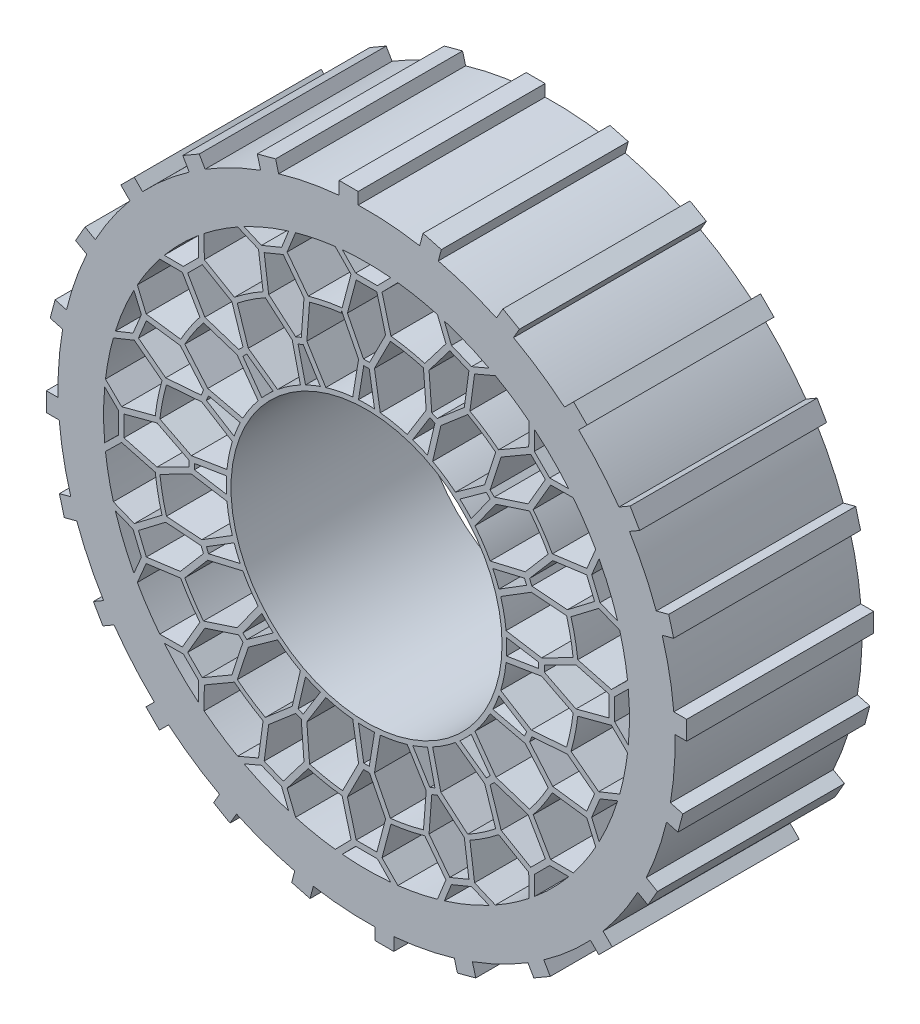
from build123d import *

# Parameters (mm, degrees)
SKETCH1_R           = 73.66
BOSS_EXTRUDE1_DEPTH = 101.6
SKETCH2_R           = 146.05
SKETCH2_R_2         = 142.875
BOSS_EXTRUDE2_DEPTH = 101.6
SKETCH4_R           = 167.64
SKETCH4_R_2         = 146.05
BOSS_EXTRUDE3_DEPTH = 101.6
BOSS_EXTRUDE5_START = -5.08
SKETCH9_W           = 101.6
SKETCH9_H           = 10.313130633
BOSS_EXTRUDE5_DEPTH = 11.43
CIRPATTERN1_COUNT   = 24
SCALE3_SCALE        = 0.85
SCALE9_SCALE        = 0.3


with BuildPart() as part:
    # Sketch1 → Boss-Extrude1 (new body)
    with BuildSketch(Plane.XY):
        with BuildLine():
            Line((38.552606872, 137.575296214), (43.145167195, 126.177323825))
            Line((43.145167195, 126.177323825), (31.670754728, 111.145797019))
            ThreePointArc((31.670754728, 111.145797019), (22.546588515, 113.349354856), (13.273693024, 114.805200115))
            Line((13.273693024, 114.805200115), (8.42503447, 133.083587621))
            Line((8.42503447, 133.083587621), (17.029822149, 141.856444276))
            ThreePointArc((17.029822149, 141.856444276), (15.09800635, 142.075035912), (13.163395022, 142.267321112))
            Line((13.163395022, 142.267321112), (5.911713965, 134.874))
            Line((5.911713965, 134.874), (-5.911713965, 134.874))
            Line((-5.911713965, 134.874), (-13.163395022, 142.267321112))
            ThreePointArc((-13.163395022, 142.267321112), (-15.09800635, 142.075035912), (-17.029822149, 141.856444276))
            Line((-17.029822149, 141.856444276), (-8.42503447, 133.083587621))
            Line((-8.42503447, 133.083587621), (-13.273693024, 114.805200115))
            ThreePointArc((-13.273693024, 114.805200115), (-22.546588515, 113.349354856), (-31.670754728, 111.145797019))
            Line((-31.670754728, 111.145797019), (-43.145167195, 126.177323825))
            Line((-43.145167195, 126.177323825), (-38.552606872, 137.575296214))
            ThreePointArc((-38.552606872, 137.575296214), (-40.421023348, 137.037974651), (-42.281955517, 136.47527931))
            Line((-42.281955517, 136.47527931), (-46.152333723, 126.869643059))
            Line((-46.152333723, 126.869643059), (-57.075756791, 122.345013077))
            Line((-57.075756791, 122.345013077), (-66.604737996, 126.400452932))
            ThreePointArc((-66.604737996, 126.400452932), (-68.318501444, 125.482460868), (-70.019615125, 124.541234629))
            Line((-70.019615125, 124.541234629), (-58.71260101, 119.729081608))
            Line((-58.71260101, 119.729081608), (-56.197341339, 100.986552206))
            ThreePointArc((-56.197341339, 100.986552206), (-64.20725183, 96.092943094), (-71.793617169, 90.565453865))
            Line((-71.793617169, 90.565453865), (-88.146908266, 100.061706277))
            Line((-88.146908266, 100.061706277), (-88.265750978, 112.349556427))
            ThreePointArc((-88.265750978, 112.349556427), (-89.786318658, 111.138124003), (-91.290261616, 109.906113383))
            Line((-91.290261616, 109.906113383), (-91.190106973, 99.550533039))
            Line((-91.190106973, 99.550533039), (-99.550533039, 91.190106973))
            Line((-99.550533039, 91.190106973), (-109.906113383, 91.290261616))
            ThreePointArc((-109.906113383, 91.290261616), (-111.138124003, 89.786318658), (-112.349556427, 88.265750978))
            Line((-112.349556427, 88.265750978), (-100.061706277, 88.146908266))
            Line((-100.061706277, 88.146908266), (-90.565453865, 71.793617169))
            ThreePointArc((-90.565453865, 71.793617169), (-96.092943094, 64.20725183), (-100.986552206, 56.197341339))
            Line((-100.986552206, 56.197341339), (-119.729081608, 58.71260101))
            Line((-119.729081608, 58.71260101), (-124.541234628, 70.019615125))
            ThreePointArc((-124.541234629, 70.019615125), (-125.482460868, 68.318501444), (-126.400452932, 66.604737996))
            Line((-126.400452932, 66.604737996), (-122.345013077, 57.075756791))
            Line((-122.345013077, 57.075756791), (-126.869643059, 46.152333723))
            Line((-126.869643059, 46.152333723), (-136.47527931, 42.281955517))
            ThreePointArc((-136.47527931, 42.281955517), (-137.037974651, 40.421023348), (-137.575296214, 38.552606872))
            Line((-137.575296214, 38.552606872), (-126.177323825, 43.145167195))
            Line((-126.177323825, 43.145167195), (-111.145797019, 31.670754728))
            ThreePointArc((-111.145797019, 31.670754728), (-113.349354856, 22.546588515), (-114.805200115, 13.273693024))
            Line((-114.805200115, 13.273693024), (-133.083587621, 8.42503447))
            Line((-133.083587621, 8.42503447), (-141.856444276, 17.029822149))
            ThreePointArc((-141.856444276, 17.029822149), (-142.075035912, 15.09800635), (-142.267321112, 13.163395022))
            Line((-142.267321112, 13.163395022), (-134.874, 5.911713965))
            Line((-134.874, 5.911713965), (-134.874, -5.911713965))
            Line((-134.874, -5.911713965), (-142.267321112, -13.163395022))
            ThreePointArc((-142.267321112, -13.163395022), (-142.075035912, -15.09800635), (-141.856444276, -17.029822149))
            Line((-141.856444276, -17.029822149), (-133.083587621, -8.42503447))
            Line((-133.083587621, -8.42503447), (-114.805200115, -13.273693024))
            ThreePointArc((-114.805200115, -13.273693024), (-113.349354856, -22.546588515), (-111.145797019, -31.670754728))
            Line((-111.145797019, -31.670754728), (-126.177323825, -43.145167195))
            Line((-126.177323825, -43.145167195), (-137.575296214, -38.552606873))
            ThreePointArc((-137.575296214, -38.552606873), (-137.037974651, -40.421023348), (-136.47527931, -42.281955517))
            Line((-136.47527931, -42.281955517), (-126.869643059, -46.152333723))
            Line((-126.869643059, -46.152333723), (-122.345013077, -57.075756791))
            Line((-122.345013077, -57.075756791), (-126.400452932, -66.604737996))
            ThreePointArc((-126.400452932, -66.604737996), (-125.482460868, -68.318501444), (-124.541234628, -70.019615125))
            Line((-124.541234628, -70.019615125), (-119.729081608, -58.71260101))
            Line((-119.729081608, -58.71260101), (-100.986552206, -56.197341339))
            ThreePointArc((-100.986552206, -56.197341339), (-96.092943094, -64.20725183), (-90.565453865, -71.793617169))
            Line((-90.565453865, -71.793617169), (-100.061706277, -88.146908266))
            Line((-100.061706277, -88.146908266), (-112.349556426, -88.265750978))
            ThreePointArc((-112.349556427, -88.265750978), (-111.138124003, -89.786318658), (-109.906113383, -91.290261616))
            Line((-109.906113383, -91.290261616), (-99.550533039, -91.190106973))
            Line((-99.550533039, -91.190106973), (-91.190106973, -99.550533039))
            Line((-91.190106973, -99.550533039), (-91.290261616, -109.906113383))
            ThreePointArc((-91.290261616, -109.906113383), (-89.786318658, -111.138124003), (-88.265750978, -112.349556427))
            Line((-88.265750978, -112.349556427), (-88.146908266, -100.061706277))
            Line((-88.146908266, -100.061706277), (-71.793617169, -90.565453865))
            ThreePointArc((-71.793617168, -90.565453865), (-64.20725183, -96.092943094), (-56.197341339, -100.986552206))
            Line((-56.197341339, -100.986552206), (-58.71260101, -119.729081608))
            Line((-58.71260101, -119.729081608), (-70.019615125, -124.541234629))
            ThreePointArc((-70.019615125, -124.541234629), (-68.318501444, -125.482460868), (-66.604737996, -126.400452932))
            Line((-66.604737996, -126.400452932), (-57.075756791, -122.345013077))
            Line((-57.075756791, -122.345013077), (-46.152333722, -126.869643059))
            Line((-46.152333722, -126.869643059), (-42.281955517, -136.47527931))
            ThreePointArc((-42.281955517, -136.47527931), (-40.421023348, -137.037974651), (-38.552606872, -137.575296214))
            Line((-38.552606872, -137.575296214), (-43.145167195, -126.177323825))
            Line((-43.145167195, -126.177323825), (-31.670754728, -111.145797019))
            ThreePointArc((-31.670754728, -111.145797019), (-22.546588515, -113.349354856), (-13.273693024, -114.805200115))
            Line((-13.273693024, -114.805200115), (-8.42503447, -133.083587621))
            Line((-8.42503447, -133.083587621), (-17.029822149, -141.856444276))
            ThreePointArc((-17.029822149, -141.856444276), (-15.09800635, -142.075035912), (-13.163395022, -142.267321112))
            Line((-13.163395022, -142.267321112), (-5.911713965, -134.874))
            Line((-5.911713965, -134.874), (5.911713965, -134.874))
            Line((5.911713965, -134.874), (13.163395022, -142.267321112))
            ThreePointArc((13.163395022, -142.267321112), (15.09800635, -142.075035912), (17.029822149, -141.856444276))
            Line((17.029822149, -141.856444276), (8.42503447, -133.083587621))
            Line((8.42503447, -133.083587621), (13.273693024, -114.805200115))
            ThreePointArc((13.273693024, -114.805200115), (22.546588516, -113.349354856), (31.670754728, -111.145797019))
            Line((31.670754728, -111.145797019), (43.145167195, -126.177323825))
            Line((43.145167195, -126.177323825), (38.552606873, -137.575296214))
            ThreePointArc((38.552606873, -137.575296214), (40.421023348, -137.037974651), (42.281955517, -136.47527931))
            Line((42.281955517, -136.47527931), (46.152333723, -126.869643059))
            Line((46.152333723, -126.869643059), (57.075756791, -122.345013077))
            Line((57.075756791, -122.345013077), (66.604737996, -126.400452932))
            ThreePointArc((66.604737996, -126.400452932), (68.318501444, -125.482460868), (70.019615125, -124.541234628))
            Line((70.019615125, -124.541234629), (58.71260101, -119.729081608))
            Line((58.71260101, -119.729081608), (56.197341339, -100.986552206))
            ThreePointArc((56.197341339, -100.986552206), (64.20725183, -96.092943094), (71.793617169, -90.565453865))
            Line((71.793617169, -90.565453865), (88.146908267, -100.061706277))
            Line((88.146908267, -100.061706277), (88.265750978, -112.349556427))
            ThreePointArc((88.265750978, -112.349556427), (89.786318658, -111.138124003), (91.290261616, -109.906113383))
            Line((91.290261616, -109.906113383), (91.190106973, -99.550533039))
            Line((91.190106973, -99.550533039), (99.550533039, -91.190106973))
            Line((99.550533039, -91.190106973), (109.906113384, -91.290261616))
            ThreePointArc((109.906113383, -91.290261616), (111.138124003, -89.786318658), (112.349556427, -88.265750978))
            Line((112.349556427, -88.265750978), (100.061706277, -88.146908266))
            Line((100.061706277, -88.146908266), (90.565453866, -71.793617168))
            ThreePointArc((90.565453866, -71.793617168), (96.092943094, -64.20725183), (100.986552206, -56.197341339))
            Line((100.986552206, -56.197341339), (119.729081608, -58.71260101))
            Line((119.729081608, -58.71260101), (124.541234629, -70.019615125))
            ThreePointArc((124.541234629, -70.019615125), (125.482460868, -68.318501444), (126.400452932, -66.604737996))
            Line((126.400452932, -66.604737996), (122.345013077, -57.075756791))
            Line((122.345013077, -57.075756791), (126.869643059, -46.152333723))
            Line((126.869643059, -46.152333723), (136.47527931, -42.281955517))
            ThreePointArc((136.47527931, -42.281955517), (137.037974651, -40.421023348), (137.575296214, -38.552606872))
            Line((137.575296214, -38.552606872), (126.177323825, -43.145167195))
            Line((126.177323825, -43.145167195), (111.145797019, -31.670754728))
            ThreePointArc((111.145797019, -31.670754728), (113.349354856, -22.546588515), (114.805200115, -13.273693024))
            Line((114.805200115, -13.273693024), (133.083587621, -8.42503447))
            Line((133.083587621, -8.42503447), (141.856444276, -17.029822149))
            ThreePointArc((141.856444276, -17.029822149), (142.075035912, -15.09800635), (142.267321112, -13.163395022))
            Line((142.267321112, -13.163395022), (134.874, -5.911713965))
            Line((134.874, -5.911713965), (134.874, 5.911713965))
            Line((134.874, 5.911713965), (142.267321112, 13.163395022))
            ThreePointArc((142.267321112, 13.163395022), (142.075035912, 15.09800635), (141.856444276, 17.029822149))
            Line((141.856444276, 17.029822149), (133.083587621, 8.42503447))
            Line((133.083587621, 8.42503447), (114.805200115, 13.273693024))
            ThreePointArc((114.805200115, 13.273693024), (113.349354856, 22.546588515), (111.145797019, 31.670754728))
            Line((111.145797019, 31.670754728), (126.177323825, 43.145167195))
            Line((126.177323825, 43.145167195), (137.575296214, 38.552606873))
            ThreePointArc((137.575296214, 38.552606873), (137.037974651, 40.421023348), (136.47527931, 42.281955517))
            Line((136.47527931, 42.281955517), (126.869643059, 46.152333723))
            Line((126.869643059, 46.152333723), (122.345013077, 57.075756791))
            Line((122.345013077, 57.075756791), (126.400452932, 66.604737996))
            ThreePointArc((126.400452932, 66.604737996), (125.482460868, 68.318501444), (124.541234629, 70.019615125))
            Line((124.541234629, 70.019615125), (119.729081608, 58.71260101))
            Line((119.729081608, 58.71260101), (100.986552206, 56.197341339))
            ThreePointArc((100.986552206, 56.197341339), (96.092943094, 64.20725183), (90.565453865, 71.793617169))
            Line((90.565453865, 71.793617169), (100.061706277, 88.146908266))
            Line((100.061706277, 88.146908266), (112.349556427, 88.265750978))
            ThreePointArc((112.349556427, 88.265750978), (111.138124003, 89.786318658), (109.906113383, 91.290261616))
            Line((109.906113383, 91.290261616), (99.550533039, 91.190106973))
            Line((99.550533039, 91.190106973), (91.190106973, 99.550533039))
            Line((91.190106973, 99.550533039), (91.290261616, 109.906113383))
            ThreePointArc((91.290261616, 109.906113383), (89.786318658, 111.138124003), (88.265750978, 112.349556427))
            Line((88.265750978, 112.349556427), (88.146908266, 100.061706277))
            Line((88.146908266, 100.061706277), (71.793617169, 90.565453865))
            ThreePointArc((71.793617169, 90.565453865), (64.20725183, 96.092943094), (56.197341339, 100.986552206))
            Line((56.197341339, 100.986552206), (58.71260101, 119.729081608))
            Line((58.71260101, 119.729081608), (70.019615125, 124.541234629))
            ThreePointArc((70.019615125, 124.541234629), (68.318501444, 125.482460868), (66.604737996, 126.400452932))
            Line((66.604737996, 126.400452932), (57.075756791, 122.345013077))
            Line((57.075756791, 122.345013077), (46.152333723, 126.869643059))
            Line((46.152333723, 126.869643059), (42.281955517, 136.47527931))
            ThreePointArc((42.281955517, 136.47527931), (40.421023348, 137.037974651), (38.552606872, 137.575296214))
        make_face()
        Polygon((55.626169895, 119.646320202), (53.149458266, 101.191032636), (38.462574405, 88.60832546), (35.458400619, 89.852694986), (33.970523016, 109.135207729), (45.269082415, 123.936366303), align=None, mode=Mode.SUBTRACT)
        with BuildLine():
            ThreePointArc((54.988136663, 98.752649212), (62.796103438, 93.981010279), (70.192502511, 88.593416749))
            Line((70.192502511, 88.593416749), (64.229390392, 70.335964555))
            Line((64.229390392, 70.335964555), (48.3314377, 58.911052697))
            ThreePointArc((48.3314377, 58.911052697), (42.334451755, 63.357984458), (35.931075353, 67.196709919))
            Line((35.931075353, 67.196709919), (40.402434477, 86.256627504))
            Line((40.402434477, 86.256627504), (54.988136663, 98.752649212))
        make_face(mode=Mode.SUBTRACT)
        with BuildLine():
            Line((32.423810835, 89.561481626), (22.108142217, 72.922356296))
            ThreePointArc((22.108142217, 72.922356296), (14.865882536, 74.735838367), (7.480917504, 75.831892191))
            Line((7.480917504, 75.831892191), (4.318, 95.152074996))
            Line((4.318, 95.152074996), (13.011411238, 112.278600266))
            ThreePointArc((13.011411238, 112.278600266), (22.051059097, 110.858160244), (30.946183599, 108.711152237))
            Line((30.946183599, 108.711152237), (32.423810835, 89.561481626))
        make_face(mode=Mode.SUBTRACT)
        with BuildLine():
            Line((37.174579294, 85.842699077), (33.134005603, 68.619076595))
            ThreePointArc((33.134005603, 68.619076595), (29.160477545, 70.399620378), (25.091734327, 71.950294429))
            Line((25.091734327, 71.950294429), (34.413557526, 86.986351739))
            Line((34.413557526, 86.986351739), (37.174579294, 85.842699077))
        make_face(mode=Mode.SUBTRACT)
        Polygon((73.148906809, 87.82782835), (89.25157275, 97.178544323), (97.178544323, 89.25157275), (87.82782835, 73.148906809), (69.443723384, 67.144428312), (67.144428312, 69.443723384), align=None, mode=Mode.SUBTRACT)
        with BuildLine():
            ThreePointArc((56.871213364, 50.715925413), (53.881536726, 53.881536727), (50.715925411, 56.871213365))
            Line((50.715925411, 56.871213365), (65.082217092, 67.195411666))
            Line((65.082217092, 67.195411666), (67.195411665, 65.082217092))
            Line((67.195411665, 65.082217092), (56.871213364, 50.715925413))
        make_face(mode=Mode.SUBTRACT)
        with BuildLine():
            ThreePointArc((67.196709918, 35.931075355), (63.357984457, 42.334451757), (58.911052695, 48.331437702))
            Line((58.911052695, 48.331437702), (70.335964555, 64.229390392))
            Line((70.335964555, 64.229390392), (88.593416749, 70.192502511))
            ThreePointArc((88.593416749, 70.192502511), (93.981010279, 62.796103438), (98.752649212, 54.988136663))
            Line((98.752649212, 54.988136663), (86.256627504, 40.402434477))
            Line((86.256627504, 40.402434477), (67.196709918, 35.931075355))
        make_face(mode=Mode.SUBTRACT)
        with BuildLine():
            ThreePointArc((71.950294429, 25.091734329), (70.399620377, 29.160477547), (68.619076593, 33.134005605))
            Line((68.619076593, 33.134005605), (85.842699077, 37.174579294))
            Line((85.842699077, 37.174579294), (86.986351739, 34.413557526))
            Line((86.986351739, 34.413557526), (71.950294429, 25.091734329))
        make_face(mode=Mode.SUBTRACT)
        with BuildLine():
            ThreePointArc((75.831892191, 7.480917507), (74.735838366, 14.865882539), (72.922356295, 22.10814222))
            Line((72.922356295, 22.10814222), (89.561481626, 32.423810835))
            Line((89.561481626, 32.423810835), (108.711152237, 30.946183599))
            ThreePointArc((108.711152237, 30.946183599), (110.858160244, 22.051059098), (112.278600266, 13.011411238))
            Line((112.278600266, 13.011411238), (95.152074996, 4.318))
            Line((95.152074996, 4.318), (75.831892191, 7.480917507))
        make_face(mode=Mode.SUBTRACT)
        with BuildLine():
            Line((76.075595398, 4.352445852), (93.534408293, 1.494254213))
            Line((93.534408293, 1.494254213), (93.534408293, -1.494254213))
            Line((93.534408293, -1.494254213), (76.075595398, -4.35244585))
            ThreePointArc((76.075595398, -4.35244585), (76.2, 1e-09), (76.075595398, 4.352445852))
        make_face(mode=Mode.SUBTRACT)
        with BuildLine():
            ThreePointArc((72.922356296, -22.108142217), (74.735838367, -14.865882536), (75.831892191, -7.480917504))
            Line((75.831892191, -7.480917504), (95.152074996, -4.318))
            Line((95.152074996, -4.318), (112.278600266, -13.011411238))
            ThreePointArc((112.278600266, -13.011411238), (110.858160244, -22.051059097), (108.711152237, -30.946183599))
            Line((108.711152237, -30.946183599), (89.561481626, -32.423810835))
            Line((89.561481626, -32.423810835), (72.922356296, -22.108142217))
        make_face(mode=Mode.SUBTRACT)
        with BuildLine():
            ThreePointArc((68.619076595, -33.134005603), (70.399620378, -29.160477545), (71.950294429, -25.091734326))
            Line((71.950294429, -25.091734326), (86.986351739, -34.413557526))
            Line((86.986351739, -34.413557526), (85.842699077, -37.174579294))
            Line((85.842699077, -37.174579294), (68.619076595, -33.134005603))
        make_face(mode=Mode.SUBTRACT)
        with BuildLine():
            ThreePointArc((58.911052697, -48.3314377), (63.357984458, -42.334451755), (67.196709919, -35.931075353))
            Line((67.196709919, -35.931075353), (86.256627504, -40.402434477))
            Line((86.256627504, -40.402434477), (98.752649212, -54.988136662))
            ThreePointArc((98.752649212, -54.988136662), (93.981010279, -62.796103438), (88.593416749, -70.192502511))
            Line((88.593416749, -70.192502511), (70.335964555, -64.229390392))
            Line((70.335964555, -64.229390392), (58.911052697, -48.3314377))
        make_face(mode=Mode.SUBTRACT)
        with BuildLine():
            ThreePointArc((50.715925413, -56.871213364), (53.881536727, -53.881536725), (56.871213366, -50.715925411))
            Line((56.871213366, -50.715925411), (67.195411666, -65.082217092))
            Line((67.195411666, -65.082217092), (65.082217092, -67.195411665))
            Line((65.082217092, -67.195411665), (50.715925413, -56.871213364))
        make_face(mode=Mode.SUBTRACT)
        with BuildLine():
            ThreePointArc((35.931075355, -67.196709918), (42.334451757, -63.357984457), (48.331437702, -58.911052695))
            Line((48.331437702, -58.911052695), (64.229390392, -70.335964555))
            Line((64.229390392, -70.335964555), (70.192502511, -88.593416749))
            ThreePointArc((70.192502511, -88.593416749), (62.796103438, -93.981010278), (54.988136663, -98.752649212))
            Line((54.988136663, -98.752649212), (40.402434478, -86.256627504))
            Line((40.402434477, -86.256627504), (35.931075355, -67.196709918))
        make_face(mode=Mode.SUBTRACT)
        with BuildLine():
            ThreePointArc((25.091734329, -71.950294429), (29.160477547, -70.399620377), (33.134005605, -68.619076593))
            Line((33.134005605, -68.619076593), (37.174579294, -85.842699077))
            Line((37.174579294, -85.842699077), (34.413557526, -86.986351739))
            Line((34.413557526, -86.986351739), (25.091734329, -71.950294429))
        make_face(mode=Mode.SUBTRACT)
        with BuildLine():
            ThreePointArc((7.480917507, -75.831892191), (14.865882539, -74.735838366), (22.10814222, -72.922356295))
            Line((22.10814222, -72.922356295), (32.423810835, -89.561481626))
            Line((32.423810835, -89.561481625), (30.946183599, -108.711152237))
            ThreePointArc((30.946183599, -108.711152237), (22.051059098, -110.858160244), (13.011411238, -112.278600266))
            Line((13.011411238, -112.278600266), (4.318, -95.152074996))
            Line((4.318, -95.152074996), (7.480917507, -75.831892191))
        make_face(mode=Mode.SUBTRACT)
        with BuildLine():
            ThreePointArc((-4.35244585, -76.075595398), (1e-09, -76.2), (4.352445853, -76.075595398))
            Line((4.352445853, -76.075595398), (1.494254213, -93.534408293))
            Line((1.494254213, -93.534408293), (-1.494254213, -93.534408293))
            Line((-1.494254213, -93.534408293), (-4.35244585, -76.075595398))
        make_face(mode=Mode.SUBTRACT)
        with BuildLine():
            ThreePointArc((-22.108142217, -72.922356296), (-14.865882536, -74.735838367), (-7.480917504, -75.831892191))
            Line((-7.480917504, -75.831892191), (-4.318, -95.152074996))
            Line((-4.318, -95.152074996), (-13.011411238, -112.278600266))
            ThreePointArc((-13.011411238, -112.278600266), (-22.051059097, -110.858160244), (-30.946183599, -108.711152237))
            Line((-30.946183599, -108.711152237), (-32.423810835, -89.561481626))
            Line((-32.423810835, -89.561481626), (-22.108142217, -72.922356296))
        make_face(mode=Mode.SUBTRACT)
        with BuildLine():
            ThreePointArc((-33.134005603, -68.619076595), (-29.160477545, -70.399620378), (-25.091734326, -71.950294429))
            Line((-25.091734326, -71.950294429), (-34.413557526, -86.986351739))
            Line((-34.413557526, -86.986351739), (-37.174579294, -85.842699077))
            Line((-37.174579294, -85.842699077), (-33.134005603, -68.619076595))
        make_face(mode=Mode.SUBTRACT)
        with BuildLine():
            ThreePointArc((-48.3314377, -58.911052697), (-42.334451755, -63.357984458), (-35.931075353, -67.196709919))
            Line((-35.931075353, -67.196709919), (-40.402434477, -86.256627504))
            Line((-40.402434477, -86.256627504), (-54.988136662, -98.752649212))
            ThreePointArc((-54.988136662, -98.752649212), (-62.796103438, -93.981010279), (-70.192502511, -88.593416749))
            Line((-70.192502511, -88.593416749), (-64.229390392, -70.335964555))
            Line((-64.229390392, -70.335964555), (-48.3314377, -58.911052697))
        make_face(mode=Mode.SUBTRACT)
        with BuildLine():
            ThreePointArc((-56.871213364, -50.715925413), (-53.881536725, -53.881536727), (-50.715925411, -56.871213365))
            Line((-50.715925411, -56.871213365), (-65.082217091, -67.195411666))
            Line((-65.082217091, -67.195411666), (-67.195411665, -65.082217092))
            Line((-67.195411665, -65.082217092), (-56.871213364, -50.715925413))
        make_face(mode=Mode.SUBTRACT)
        with BuildLine():
            ThreePointArc((-67.196709918, -35.931075355), (-63.357984457, -42.334451757), (-58.911052695, -48.331437702))
            Line((-58.911052695, -48.331437702), (-70.335964555, -64.229390392))
            Line((-70.335964555, -64.229390392), (-88.593416749, -70.192502511))
            ThreePointArc((-88.593416749, -70.192502511), (-93.981010279, -62.796103438), (-98.752649212, -54.988136663))
            Line((-98.752649212, -54.988136663), (-86.256627504, -40.402434477))
            Line((-86.256627504, -40.402434477), (-67.196709918, -35.931075355))
        make_face(mode=Mode.SUBTRACT)
        with BuildLine():
            ThreePointArc((-71.950294429, -25.091734329), (-70.399620377, -29.160477547), (-68.619076593, -33.134005605))
            Line((-68.619076593, -33.134005605), (-85.842699077, -37.174579294))
            Line((-85.842699077, -37.174579294), (-86.986351739, -34.413557526))
            Line((-86.986351739, -34.413557526), (-71.950294429, -25.091734329))
        make_face(mode=Mode.SUBTRACT)
        with BuildLine():
            ThreePointArc((-75.831892191, -7.480917507), (-74.735838366, -14.865882539), (-72.922356295, -22.10814222))
            Line((-72.922356295, -22.10814222), (-89.561481626, -32.423810835))
            Line((-89.561481625, -32.423810835), (-108.711152237, -30.946183599))
            ThreePointArc((-108.711152237, -30.946183599), (-110.858160244, -22.051059098), (-112.278600266, -13.011411238))
            Line((-112.278600266, -13.011411238), (-95.152074996, -4.318))
            Line((-95.152074996, -4.318), (-75.831892191, -7.480917507))
        make_face(mode=Mode.SUBTRACT)
        with BuildLine():
            ThreePointArc((-76.075595398, 4.35244585), (-76.2, -1e-09), (-76.075595398, -4.352445852))
            Line((-76.075595398, -4.352445852), (-93.534408293, -1.494254213))
            Line((-93.534408293, -1.494254213), (-93.534408293, 1.494254213))
            Line((-93.534408293, 1.494254213), (-76.075595398, 4.35244585))
        make_face(mode=Mode.SUBTRACT)
        with BuildLine():
            ThreePointArc((-72.922356296, 22.108142217), (-74.735838367, 14.865882536), (-75.831892191, 7.480917504))
            Line((-75.831892191, 7.480917504), (-95.152074996, 4.318))
            Line((-95.152074996, 4.318), (-112.278600266, 13.011411238))
            ThreePointArc((-112.278600266, 13.011411238), (-110.858160244, 22.051059097), (-108.711152237, 30.946183599))
            Line((-108.711152237, 30.946183599), (-89.561481625, 32.423810835))
            Line((-89.561481626, 32.423810835), (-72.922356296, 22.108142217))
        make_face(mode=Mode.SUBTRACT)
        with BuildLine():
            ThreePointArc((-68.619076595, 33.134005603), (-70.399620378, 29.160477545), (-71.950294429, 25.091734327))
            Line((-71.950294429, 25.091734327), (-86.986351739, 34.413557526))
            Line((-86.986351739, 34.413557526), (-85.842699077, 37.174579294))
            Line((-85.842699077, 37.174579294), (-68.619076595, 33.134005603))
        make_face(mode=Mode.SUBTRACT)
        with BuildLine():
            ThreePointArc((-58.911052697, 48.3314377), (-63.357984458, 42.334451755), (-67.196709919, 35.931075353))
            Line((-67.196709919, 35.931075353), (-86.256627504, 40.402434477))
            Line((-86.256627504, 40.402434477), (-98.752649212, 54.988136663))
            ThreePointArc((-98.752649212, 54.988136663), (-93.981010279, 62.796103438), (-88.593416749, 70.192502511))
            Line((-88.593416749, 70.192502511), (-70.335964555, 64.229390392))
            Line((-70.335964555, 64.229390392), (-58.911052697, 48.3314377))
        make_face(mode=Mode.SUBTRACT)
        with BuildLine():
            ThreePointArc((-50.715925413, 56.871213364), (-53.881536727, 53.881536726), (-56.871213365, 50.715925411))
            Line((-56.871213365, 50.715925411), (-67.195411666, 65.082217092))
            Line((-67.195411666, 65.082217092), (-65.082217092, 67.195411665))
            Line((-65.082217092, 67.195411665), (-50.715925413, 56.871213364))
        make_face(mode=Mode.SUBTRACT)
        with BuildLine():
            ThreePointArc((-35.931075355, 67.196709918), (-42.334451757, 63.357984457), (-48.331437702, 58.911052695))
            Line((-48.331437702, 58.911052695), (-64.229390392, 70.335964555))
            Line((-64.229390392, 70.335964555), (-70.192502511, 88.593416749))
            ThreePointArc((-70.192502511, 88.593416749), (-62.796103438, 93.981010279), (-54.988136663, 98.752649212))
            Line((-54.988136663, 98.752649212), (-40.402434477, 86.256627504))
            Line((-40.402434477, 86.256627504), (-35.931075355, 67.196709918))
        make_face(mode=Mode.SUBTRACT)
        with BuildLine():
            ThreePointArc((-25.091734329, 71.950294429), (-29.160477547, 70.399620377), (-33.134005605, 68.619076593))
            Line((-33.134005605, 68.619076593), (-37.174579294, 85.842699077))
            Line((-37.174579294, 85.842699077), (-34.413557526, 86.986351739))
            Line((-34.413557526, 86.986351739), (-25.091734329, 71.950294429))
        make_face(mode=Mode.SUBTRACT)
        with BuildLine():
            ThreePointArc((-7.480917507, 75.831892191), (-14.865882539, 74.735838366), (-22.10814222, 72.922356295))
            Line((-22.10814222, 72.922356295), (-32.423810835, 89.561481626))
            Line((-32.423810835, 89.561481625), (-30.946183599, 108.711152237))
            ThreePointArc((-30.946183599, 108.711152237), (-22.252371704, 110.817926589), (-13.419182497, 112.230594942))
            Line((-13.419182497, 112.230594942), (-13.623857719, 113.485155421))
            Line((-13.623857719, 113.485155421), (-4.318, 95.152074996))
            Line((-4.318, 95.152074996), (-7.480917507, 75.831892191))
        make_face(mode=Mode.SUBTRACT)
        with BuildLine():
            ThreePointArc((4.35244585, 76.075595398), (-1e-09, 76.2), (-4.352445852, 76.075595398))
            Line((-4.352445852, 76.075595398), (-1.494254213, 93.534408293))
            Line((-1.494254213, 93.534408293), (1.494254213, 93.534408293))
            Line((1.494254213, 93.534408293), (4.35244585, 76.075595398))
        make_face(mode=Mode.SUBTRACT)
        Circle(SKETCH1_R, mode=Mode.SUBTRACT)
        Polygon((10.379564962, 113.827741044), (1.625847137, 96.582408293), (-1.625847137, 96.582408293), (-10.379564962, 113.827741044), (-5.605215353, 131.826), (5.605215353, 131.826), align=None, mode=Mode.SUBTRACT)
        Polygon((88.60832546, 38.462574405), (101.191032636, 53.149458266), (119.646320202, 55.626169895), (123.936366303, 45.269082415), (109.135207729, 33.970523016), (89.852694986, 35.458400619), align=None, mode=Mode.SUBTRACT)
        Polygon((96.582408293, 1.625847137), (113.827741044, 10.379564962), (131.826, 5.605215353), (131.826, -5.605215353), (113.827741044, -10.379564962), (96.582408293, -1.625847137), align=None, mode=Mode.SUBTRACT)
        Polygon((89.852694986, -35.458400619), (109.135207729, -33.970523016), (123.936366303, -45.269082415), (119.646320202, -55.626169895), (101.191032636, -53.149458266), (88.60832546, -38.462574405), align=None, mode=Mode.SUBTRACT)
        Polygon((69.443723384, -67.144428312), (87.82782835, -73.148906809), (97.178544323, -89.25157275), (89.25157275, -97.178544323), (73.148906809, -87.82782835), (67.144428312, -69.443723383), align=None, mode=Mode.SUBTRACT)
        Polygon((38.462574405, -88.60832546), (53.149458266, -101.191032636), (55.626169895, -119.646320202), (45.269082415, -123.936366303), (33.970523016, -109.135207729), (35.458400619, -89.852694986), align=None, mode=Mode.SUBTRACT)
        Polygon((1.625847137, -96.582408293), (10.379564962, -113.827741044), (5.605215353, -131.826), (-5.605215353, -131.826), (-10.379564962, -113.827741044), (-1.625847137, -96.582408293), align=None, mode=Mode.SUBTRACT)
        Polygon((-38.462574405, -88.60832546), (-35.458400619, -89.852694986), (-33.970523016, -109.135207729), (-45.269082415, -123.936366303), (-55.626169895, -119.646320202), (-53.149458266, -101.191032636), align=None, mode=Mode.SUBTRACT)
        Polygon((-69.443723383, -67.144428312), (-67.144428312, -69.443723384), (-73.148906809, -87.82782835), (-89.25157275, -97.178544323), (-97.178544323, -89.25157275), (-87.82782835, -73.148906809), align=None, mode=Mode.SUBTRACT)
        Polygon((-89.852694986, -35.458400619), (-88.60832546, -38.462574405), (-101.191032636, -53.149458266), (-119.646320202, -55.626169895), (-123.936366303, -45.269082415), (-109.135207729, -33.970523016), align=None, mode=Mode.SUBTRACT)
        Polygon((-96.582408293, 1.625847137), (-96.582408293, -1.625847137), (-113.827741044, -10.379564962), (-131.826, -5.605215353), (-131.826, 5.605215353), (-113.827741044, 10.379564962), align=None, mode=Mode.SUBTRACT)
        Polygon((-88.60832546, 38.462574405), (-89.852694986, 35.458400619), (-109.135207729, 33.970523016), (-123.936366303, 45.269082415), (-119.646320202, 55.626169895), (-101.191032636, 53.149458266), align=None, mode=Mode.SUBTRACT)
        Polygon((-67.144428312, 69.443723383), (-69.443723384, 67.144428312), (-87.82782835, 73.148906809), (-97.178544323, 89.25157275), (-89.25157275, 97.178544323), (-73.148906809, 87.82782835), align=None, mode=Mode.SUBTRACT)
        Polygon((-35.458400619, 89.852694986), (-38.462574405, 88.60832546), (-53.149458266, 101.191032636), (-55.626169895, 119.646320202), (-45.269082415, 123.936366303), (-33.970523016, 109.135207729), align=None, mode=Mode.SUBTRACT)
    extrude(amount=BOSS_EXTRUDE1_DEPTH)



with BuildPart() as body_2:
    # Sketch2 → Boss-Extrude2 (new body)
    with BuildSketch(Plane.XY.offset(101.6)):
        Circle(SKETCH2_R)
        Circle(SKETCH2_R_2, mode=Mode.SUBTRACT)
    extrude(amount=-BOSS_EXTRUDE2_DEPTH)


with BuildPart() as part_1:
    add(part.part)

    add(body_2.part)  # Boss-Extrude3 merges body 2
    # Sketch4 → Boss-Extrude3 (add)
    with BuildSketch(Plane.XY.offset(101.6)):
        Circle(SKETCH4_R)
        Circle(SKETCH4_R_2, mode=Mode.SUBTRACT)
    extrude(amount=-BOSS_EXTRUDE3_DEPTH)

    # Sketch9 → Boss-Extrude5 (add)
    with BuildSketch(Plane(origin=(167.64, 0, 0), x_dir=(0, 0, -1), z_dir=(1, 0, 0)).offset(BOSS_EXTRUDE5_START)):
        with Locations((-50.8, 9.677906054)):
            Rectangle(SKETCH9_W, SKETCH9_H)
    boss_extrude5 = extrude(amount=BOSS_EXTRUDE5_DEPTH)

    # CirPattern1: Boss-Extrude5 ×24 about axis
    cirpattern1_axis = Axis((0, 0, 1054.684861828), (0, 0, -1))
    for i in range(1, CIRPATTERN1_COUNT):
        add(boss_extrude5.rotate(cirpattern1_axis, i * 360 / CIRPATTERN1_COUNT))


with BuildPart() as part_2:
    # Scale3: scaled about (9.8086e-05, -0.000827686, 50.8)
    add(part_1.part.scale(SCALE3_SCALE).moved(Location((1.4713e-05, -0.000124153, 7.62))))


with BuildPart() as part_3:
    # Scale9: scaled about (9.8086e-05, -0.000827686, 50.8)
    add(part_2.part.scale(SCALE9_SCALE).moved(Location((6.866e-05, -0.00057938, 35.56))))


solid = part_3.part
